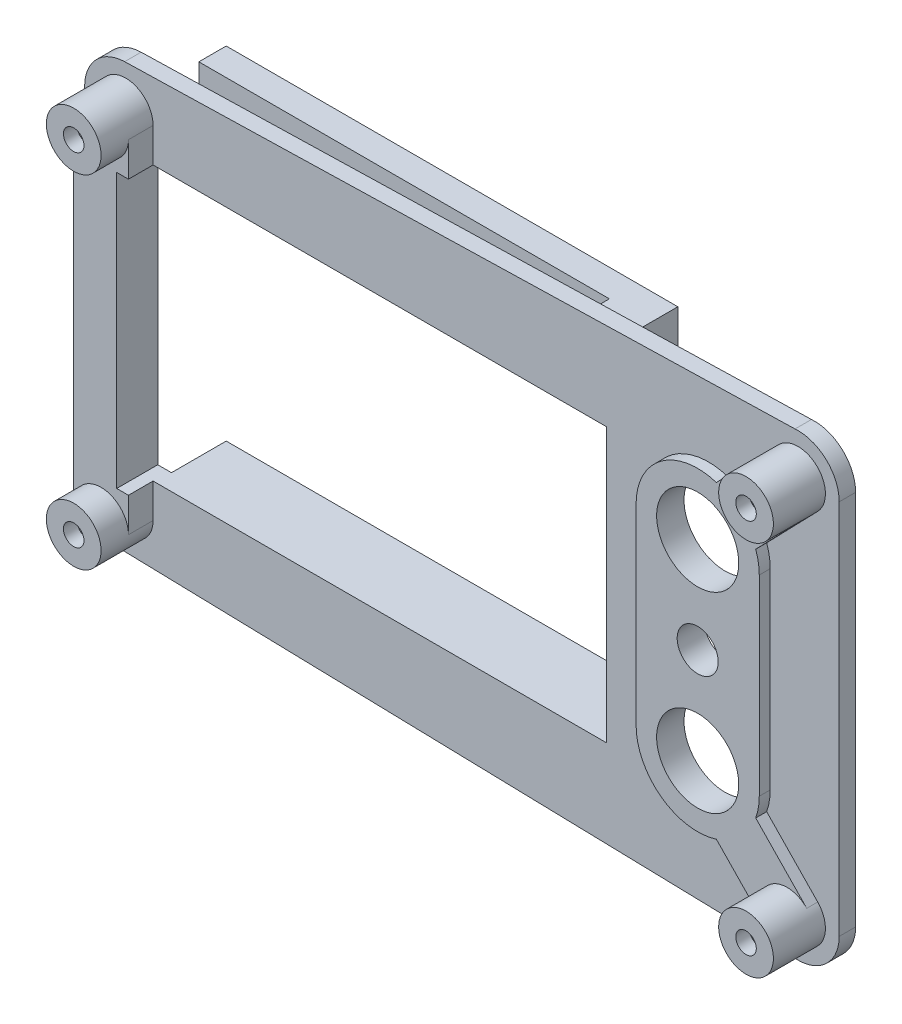
from build123d import *

# Parameters (mm, degrees)
EXTRUDE_1_DEPTH      = 1.2
SKETCH_2_8_R         = 1.5
EXTRUDE_7_DEPTH      = 2
SKETCH_2_9_R         = 1.5
EXTRUDE_8_DEPTH      = 5
SKETCH_2_10_R        = 1.5
EXTRUDE_9_DEPTH      = 5
SKETCH_2_11_R        = 1.5
EXTRUDE_10_DEPTH     = 5
SKETCH_2_12_R        = 1.5
EXTRUDE_11_DEPTH     = 5
SKETCH_2_13_R        = 1.5
SKETCH_2_13_R_2      = 0.75
EXTRUDE_12_DEPTH     = 5
SKETCH_2_14_R        = 1.5
SKETCH_2_14_R_2      = 0.75
EXTRUDE_13_DEPTH     = 5
SKETCH_2_15_R        = 1.5
SKETCH_2_15_R_2      = 0.75
EXTRUDE_14_DEPTH     = 5
SKETCH_2_16_R        = 1.5
SKETCH_2_16_R_2      = 0.75
EXTRUDE_15_DEPTH     = 5
SKETCH_2_19_R        = 1.5
SKETCH_2_19_R_2      = 0.75
CUT_EXTRUDE_4_DEPTH  = 4
SKETCH_2_20_R        = 1.5
SKETCH_2_20_R_2      = 0.75
CUT_EXTRUDE_5_DEPTH  = 4
SKETCH_2_21_R        = 1.5
SKETCH_2_21_R_2      = 0.75
CUT_EXTRUDE_6_DEPTH  = 4
SKETCH_2_22_R        = 1.5
SKETCH_2_22_R_2      = 0.75
CUT_EXTRUDE_7_DEPTH  = 4
EXTRUDE_16_DEPTH     = 3
EXTRUDE_18_DEPTH     = 2
SKETCH_3_W           = 33
SKETCH_3_H           = 5
EXTRUDE_21_DEPTH     = 4
SKETCH_4_W           = 30
SKETCH_4_H           = 2
CUT_EXTRUDE_9_DEPTH  = 2
SKETCH_5_W           = 30
SKETCH_5_H           = 2
CUT_EXTRUDE_10_DEPTH = 2


with BuildPart() as part:
    # 草图2 → 凸台-拉伸1 (new body)
    with BuildSketch(Plane.XY):
        with BuildLine():
            Line((-0.220057138, 2.999023685), (-49.204110666, 1.749023685))
            ThreePointArc((-49.204110666, 1.749023685), (-51.275787659, 0.844087888), (-52.127580054, -1.25))
            Line((-52.127580054, -1.25), (-52.127580054, -26.25))
            ThreePointArc((-52.127580054, -26.25), (-51.275787659, -28.344087888), (-49.204110666, -29.249023685))
            Line((-49.204110666, -29.249023685), (-0.220057138, -30.499023685))
            ThreePointArc((-0.220057138, -30.499023685), (2.04705122, -29.702759522), (3.007086332, -27.5))
            Line((3.007086332, -27.5), (3.007086332, 0))
            ThreePointArc((3.007086332, 0), (2.04705122, 2.202759522), (-0.220057138, 2.999023685))
        make_face()
        with BuildLine():
            ThreePointArc((2, -27.5), (0.750249731, -29.353948581), (-1.437125342, -28.890924423))
            Line((-1.437125342, -28.890924423), (-5.166627539, -25.037543154))
            ThreePointArc((-5.166627539, -25.037543154), (-9.188308261, -24.383089324), (-11.033, -20.75))
            Line((-11.033, -20.75), (-11.033, -6.75))
            ThreePointArc((-11.033, -6.75), (-9.188308261, -3.116910676), (-5.166627539, -2.462456846))
            Line((-5.166627539, -2.462456846), (-1.437125342, 1.390924423))
            ThreePointArc((-1.437125342, 1.390924423), (0.750249731, 1.853948581), (2, 0))
            ThreePointArc((2, 0), (1.853948581, -0.750249731), (1.437125342, -1.390924423))
            Line((1.437125342, -1.390924423), (-2.292376856, -5.244305693))
            ThreePointArc((-2.292376856, -5.244305693), (-2.098318267, -5.986064188), (-2.033, -6.75))
            Line((-2.033, -6.75), (-2.033, -20.75))
            ThreePointArc((-2.033, -20.75), (-2.098318267, -21.513935812), (-2.292376856, -22.255694307))
            Line((-2.292376856, -22.255694307), (1.437125342, -26.109075577))
            ThreePointArc((1.437125342, -26.109075577), (1.853948581, -26.749750269), (2, -27.5))
        make_face(mode=Mode.SUBTRACT)
        with BuildLine():
            ThreePointArc((-47.127580054, -26.25), (-49.127580054, -28.25), (-51.127580054, -26.25))
            Line((-51.127580054, -26.25), (-51.127580054, -1.25))
            ThreePointArc((-51.127580054, -1.25), (-49.127580054, 0.75), (-47.127580054, -1.25))
            Line((-47.127580054, -1.25), (-47.127580054, -3.75))
            Line((-47.127580054, -3.75), (-13.984053528, -3.75))
            Line((-13.984053528, -3.75), (-13.984053528, -13.75))
            Line((-13.984053528, -13.75), (-13.984053528, -23.75))
            Line((-13.984053528, -23.75), (-47.127580054, -23.75))
            Line((-47.127580054, -23.75), (-47.127580054, -26.25))
        make_face(mode=Mode.SUBTRACT)
    extrude(amount=EXTRUDE_1_DEPTH)

    # 草图2<8> → 凸台-拉伸7 (add)
    with BuildSketch(Plane.XY):
        with BuildLine():
            ThreePointArc((-11.033, -20.75), (-9.188308261, -24.383089324), (-5.166627539, -25.037543154))
            Line((-5.166627539, -25.037543154), (-6.415024561, -23.747679402))
            ThreePointArc((-6.415024561, -23.747679402), (-8.695628761, -18.670808609), (-3.533, -20.75))
            ThreePointArc((-3.533, -20.75), (-3.534944099, -20.857985255), (-3.540773877, -20.965830555))
            Line((-3.540773877, -20.965830555), (-2.292376856, -22.255694307))
            ThreePointArc((-2.292376856, -22.255694307), (-2.098318267, -21.513935812), (-2.033, -20.75))
            Line((-2.033, -20.75), (-2.033, -6.75))
            ThreePointArc((-2.033, -6.75), (-2.098318267, -5.986064188), (-2.292376856, -5.244305693))
            Line((-2.292376856, -5.244305693), (-3.540773877, -6.534169445))
            ThreePointArc((-3.540773877, -6.534169445), (-3.534944099, -6.642014745), (-3.533, -6.75))
            ThreePointArc((-3.533, -6.75), (-8.695628761, -8.829191391), (-6.415024561, -3.752320598))
            Line((-6.415024561, -3.752320598), (-5.166627539, -2.462456846))
            ThreePointArc((-5.166627539, -2.462456846), (-9.188308261, -3.116910676), (-11.033, -6.75))
            Line((-11.033, -6.75), (-11.033, -20.75))
        make_face()
        with Locations((-6.533, -13.75)):
            Circle(SKETCH_2_8_R, mode=Mode.SUBTRACT)
    extrude(amount=EXTRUDE_7_DEPTH)

    # 草图2<9> → 凸台-拉伸8 (add)
    with BuildSketch(Plane.XY):
        with BuildLine():
            ThreePointArc((-47.127580054, -1.25), (-49.127580054, 0.75), (-51.127580054, -1.25))
            ThreePointArc((-51.127580054, -1.25), (-49.127580054, -3.25), (-47.127580054, -1.25))
        make_face()
        with Locations((-49.127580054, -1.25)):
            Circle(SKETCH_2_9_R, mode=Mode.SUBTRACT)
    extrude(amount=EXTRUDE_8_DEPTH)

    # 草图2<10> → 凸台-拉伸9 (add)
    with BuildSketch(Plane.XY):
        with BuildLine():
            ThreePointArc((1.437125342, -26.109075577), (-1.390924423, -26.062874658), (-1.437125342, -28.890924423))
            ThreePointArc((-1.437125342, -28.890924423), (0.750249731, -29.353948581), (2, -27.5))
            ThreePointArc((2, -27.5), (1.853948581, -26.749750269), (1.437125342, -26.109075577))
        make_face()
        with Locations((0, -27.5)):
            Circle(SKETCH_2_10_R, mode=Mode.SUBTRACT)
    extrude(amount=EXTRUDE_9_DEPTH)

    # 草图2<11> → 凸台-拉伸10 (add)
    with BuildSketch(Plane.XY):
        with BuildLine():
            ThreePointArc((2, 0), (0.750249731, 1.853948581), (-1.437125342, 1.390924423))
            ThreePointArc((-1.437125342, 1.390924423), (-1.390924423, -1.437125342), (1.437125342, -1.390924423))
            ThreePointArc((1.437125342, -1.390924423), (1.853948581, -0.750249731), (2, 0))
        make_face()
        Circle(SKETCH_2_11_R, mode=Mode.SUBTRACT)
    extrude(amount=EXTRUDE_10_DEPTH)

    # 草图2<12> → 凸台-拉伸11 (add)
    with BuildSketch(Plane.XY):
        with BuildLine():
            ThreePointArc((-47.127580054, -26.25), (-49.127580054, -24.25), (-51.127580054, -26.25))
            ThreePointArc((-51.127580054, -26.25), (-49.127580054, -28.25), (-47.127580054, -26.25))
        make_face()
        with Locations((-49.127580054, -26.25)):
            Circle(SKETCH_2_12_R, mode=Mode.SUBTRACT)
    extrude(amount=EXTRUDE_11_DEPTH)

    # 草图2<13> → 凸台-拉伸12 (add)
    with BuildSketch(Plane.XY):
        with Locations((-49.127580054, -1.25)):
            Circle(SKETCH_2_13_R)
        with Locations((-49.127580054, -1.25)):
            Circle(SKETCH_2_13_R_2, mode=Mode.SUBTRACT)
    extrude(amount=EXTRUDE_12_DEPTH)

    # 草图2<14> → 凸台-拉伸13 (add)
    with BuildSketch(Plane.XY):
        with Locations((-49.127580054, -26.25)):
            Circle(SKETCH_2_14_R)
        with Locations((-49.127580054, -26.25)):
            Circle(SKETCH_2_14_R_2, mode=Mode.SUBTRACT)
    extrude(amount=EXTRUDE_13_DEPTH)

    # 草图2<15> → 凸台-拉伸14 (add)
    with BuildSketch(Plane.XY):
        Circle(SKETCH_2_15_R)
        Circle(SKETCH_2_15_R_2, mode=Mode.SUBTRACT)
    extrude(amount=EXTRUDE_14_DEPTH)

    # 草图2<16> → 凸台-拉伸15 (add)
    with BuildSketch(Plane.XY):
        with Locations((0, -27.5)):
            Circle(SKETCH_2_16_R)
        with Locations((0, -27.5)):
            Circle(SKETCH_2_16_R_2, mode=Mode.SUBTRACT)
    extrude(amount=EXTRUDE_15_DEPTH)

    # 草图2<19> → 切除-拉伸4 (cut)
    with BuildSketch(Plane.XY):
        with Locations((-49.127580054, -1.25)):
            Circle(SKETCH_2_19_R)
        with Locations((-49.127580054, -1.25)):
            Circle(SKETCH_2_19_R_2, mode=Mode.SUBTRACT)
    extrude(amount=CUT_EXTRUDE_4_DEPTH, mode=Mode.SUBTRACT)

    # 草图2<20> → 切除-拉伸5 (cut)
    with BuildSketch(Plane.XY):
        with Locations((-49.127580054, -26.25)):
            Circle(SKETCH_2_20_R)
        with Locations((-49.127580054, -26.25)):
            Circle(SKETCH_2_20_R_2, mode=Mode.SUBTRACT)
    extrude(amount=CUT_EXTRUDE_5_DEPTH, mode=Mode.SUBTRACT)

    # 草图2<21> → 切除-拉伸6 (cut)
    with BuildSketch(Plane.XY):
        with Locations((0, -27.5)):
            Circle(SKETCH_2_21_R)
        with Locations((0, -27.5)):
            Circle(SKETCH_2_21_R_2, mode=Mode.SUBTRACT)
    extrude(amount=CUT_EXTRUDE_6_DEPTH, mode=Mode.SUBTRACT)

    # 草图2<22> → 切除-拉伸7 (cut)
    with BuildSketch(Plane.XY):
        Circle(SKETCH_2_22_R)
        Circle(SKETCH_2_22_R_2, mode=Mode.SUBTRACT)
    extrude(amount=CUT_EXTRUDE_7_DEPTH, mode=Mode.SUBTRACT)

    # 草图2<23> → 凸台-拉伸16 (add)
    with BuildSketch(Plane.XY):
        with BuildLine():
            Line((-51.127580054, -1.25), (-51.127580054, -26.25))
            ThreePointArc((-51.127580054, -26.25), (-49.127580054, -24.25), (-47.127580054, -26.25))
            Line((-47.127580054, -26.25), (-47.127580054, -23.75))
            Line((-47.127580054, -23.75), (-47.984053528, -23.75))
            Line((-47.984053528, -23.75), (-47.984053528, -13.75))
            Line((-47.984053528, -13.75), (-47.984053528, -3.75))
            Line((-47.984053528, -3.75), (-47.127580054, -3.75))
            Line((-47.127580054, -3.75), (-47.127580054, -1.25))
            ThreePointArc((-47.127580054, -1.25), (-49.127580054, -3.25), (-51.127580054, -1.25))
        make_face()
    extrude(amount=EXTRUDE_16_DEPTH)

    # 草图2<24> → 凸台-拉伸18 (add)
    with BuildSketch(Plane.XY):
        with BuildLine():
            ThreePointArc((-1.437125342, -28.890924423), (-1.390924423, -26.062874658), (1.437125342, -26.109075577))
            Line((1.437125342, -26.109075577), (-3.540773877, -20.965830555))
            ThreePointArc((-3.540773877, -20.965830555), (-4.446613365, -22.905688013), (-6.415024561, -23.747679402))
            Line((-6.415024561, -23.747679402), (-1.437125342, -28.890924423))
        make_face()
        with BuildLine():
            Line((-3.540773877, -6.534169445), (1.437125342, -1.390924423))
            ThreePointArc((1.437125342, -1.390924423), (-1.390924423, -1.437125342), (-1.437125342, 1.390924423))
            Line((-1.437125342, 1.390924423), (-6.415024561, -3.752320598))
            ThreePointArc((-6.415024561, -3.752320598), (-4.446613365, -4.594311987), (-3.540773877, -6.534169445))
        make_face()
    extrude(amount=EXTRUDE_18_DEPTH)

    # 草图3 → 凸台-拉伸21 (add)
    with BuildSketch(Plane(origin=(0, 0, 0), x_dir=(-1, 0, 0), z_dir=(0, 0, -1))):
        with Locations((30.484053528, -26.25)):
            Rectangle(SKETCH_3_W, SKETCH_3_H)
        with Locations((30.484053528, -1.25)):
            Rectangle(SKETCH_3_W, SKETCH_3_H)
    extrude(amount=EXTRUDE_21_DEPTH)

    # 草图4 → 切除-拉伸9 (cut)
    with BuildSketch(Plane.XZ.offset(28.75)):
        with Locations((-31.984053528, -1)):
            Rectangle(SKETCH_4_W, SKETCH_4_H)
    extrude(amount=-CUT_EXTRUDE_9_DEPTH, mode=Mode.SUBTRACT)

    # 草图5 → 切除-拉伸10 (cut)
    with BuildSketch(Plane(origin=(0, 1.25, 0), x_dir=(1, 0, 0), z_dir=(0, 1, 0))):
        with Locations((-31.984053528, 1)):
            Rectangle(SKETCH_5_W, SKETCH_5_H)
    extrude(amount=-CUT_EXTRUDE_10_DEPTH, mode=Mode.SUBTRACT)


solid = part.part
